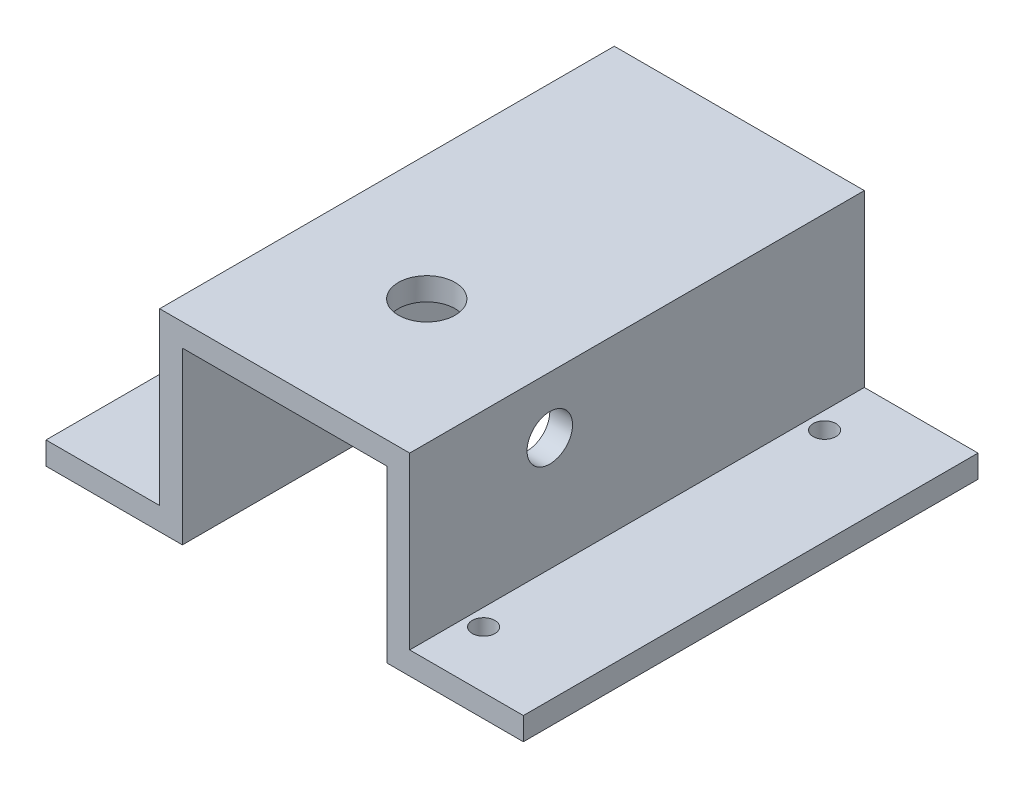
from build123d import *

# Parameters (mm, degrees)
BOSS_EXTRUDE1_DEPTH = 80
SKETCH2_R           = 2
CUT_EXTRUDE1_DEPTH  = 70
SKETCH3_R           = 5
CUT_EXTRUDE2_DEPTH  = 70
SKETCH4_R           = 4
CUT_EXTRUDE3_DEPTH  = 70


with BuildPart() as part:
    # Sketch1 → Boss-Extrude1 (new body)
    with BuildSketch(Plane.XY):
        Polygon((22, 32.945021131), (-22, 32.945021131), (-22, 2.945021131), (-42, 2.945021131), (-42, -1.054978869), (-18, -1.054978869), (-18, 28.945021131), (18, 28.945021131), (18, -1.054978869), (42, -1.054978869), (42, 2.945021131), (22, 2.945021131), align=None)
    extrude(amount=BOSS_EXTRUDE1_DEPTH)

    # Sketch2 → Cut-Extrude1 (cut)
    with BuildSketch(Plane(origin=(0, 2.945021131, 0), x_dir=(1, 0, 0), z_dir=(0, 1, 0))):
        with Locations((25, -10)):
            Circle(SKETCH2_R)
        with Locations((25, -70)):
            Circle(SKETCH2_R)
        with Locations((-25, -70)):
            Circle(SKETCH2_R)
        with Locations((-25, -10)):
            Circle(SKETCH2_R)
    extrude(amount=-CUT_EXTRUDE1_DEPTH, mode=Mode.SUBTRACT)

    # Sketch3 → Cut-Extrude2 (cut)
    with BuildSketch(Plane(origin=(0, 32.945021131, 0), x_dir=(1, 0, 0), z_dir=(0, 1, 0))):
        with Locations((0, -55)):
            Circle(SKETCH3_R)
    extrude(amount=-CUT_EXTRUDE2_DEPTH, mode=Mode.SUBTRACT)

    # Sketch4 → Cut-Extrude3 (cut)
    with BuildSketch(Plane.ZY.offset(22)):
        with Locations((55.346617858, 22.945021131)):
            Circle(SKETCH4_R)
    extrude(amount=-CUT_EXTRUDE3_DEPTH, mode=Mode.SUBTRACT)


solid = part.part
